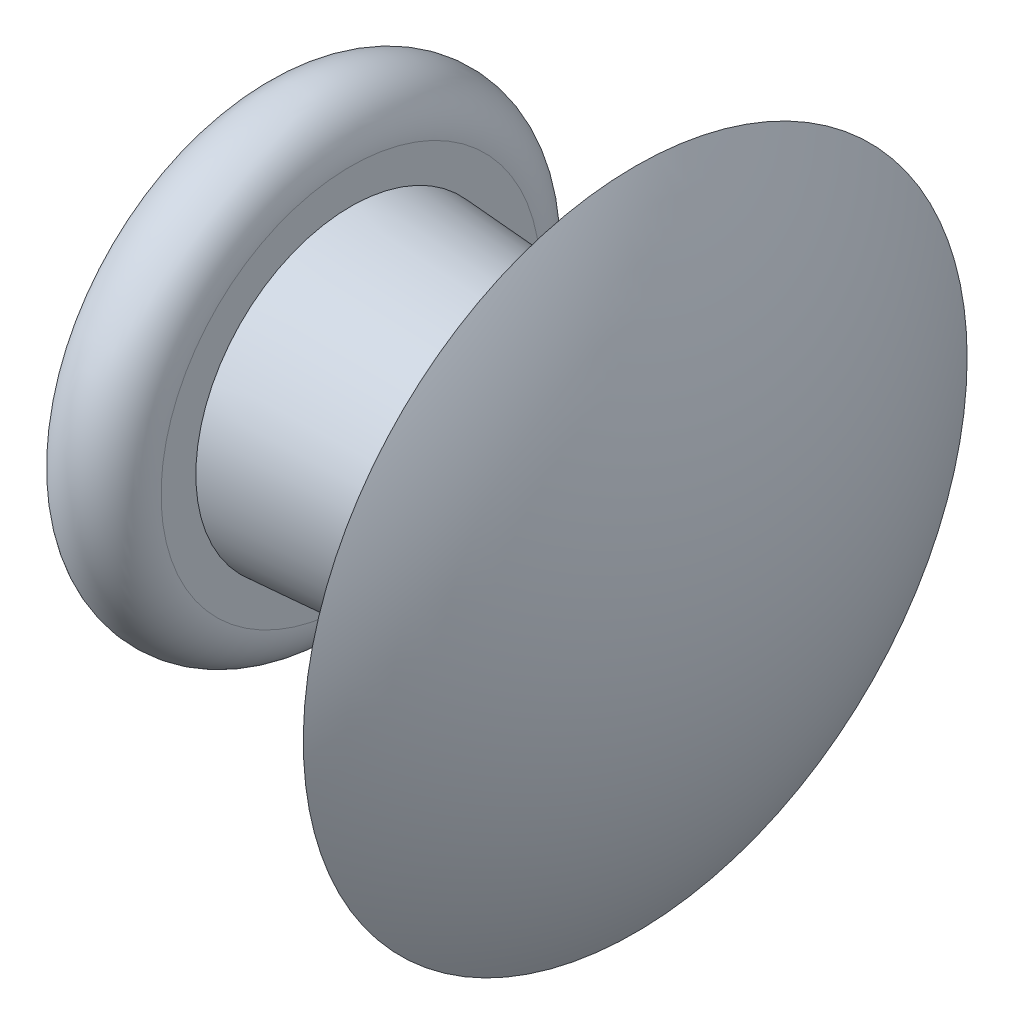
from build123d import *

# Parameters (mm, degrees)
CUT_EXTRUDE_1_DEPTH      = 64.231655884
CUT_EXTRUDE_1_DEPTH_BACK = 64.231655884
SKETCH_1_W               = 40
SKETCH_1_H               = 9


# Read off the part's stored shape, not the designer's step: Кнопка канцелярская
with BuildPart() as part:
    # Other 325 outline → Other 325 (revolve)
    with BuildSketch(Plane(origin=(0, 17.801844428, 11.6152978), x_dir=(0, 1, 0), z_dir=(0, 0, -1))):
        with BuildLine():
            Line((0, -32.931249855), (0, -44.931249855))
            Line((0, -44.931249855), (4.5, -44.931249855))
            ThreePointArc((4.5, -44.931249855), (3.767766953, -43.163482902), (2, -42.431249855))
            Line((2, -42.431249855), (1.5, -34.931249855))
            Line((1.5, -34.931249855), (3.500000006, -33.931249858))
            ThreePointArc((3.500000006, -33.931249858), (1.820027476, -33.186153702), (0, -32.931249855))
        make_face()
    revolve(axis=Axis((0, 17.801844428, 11.6152978), (1, 0, 0)))


with BuildPart() as body_2:
    # Other 325 2 outline → Other 325 2 (revolve)
    with BuildSketch(Plane(origin=(0, 17.801844428, 11.6152978), x_dir=(0, 1, 0), z_dir=(0, 0, -1))):
        with BuildLine():
            Line((0.6, -44.931249855), (0, -44.931249855))
            Line((0, -44.931249855), (0, -56.931249855))
            Line((0, -56.931249855), (0.489363529, -53.66882633))
            ThreePointArc((0.489363529, -53.66882633), (0.572302525, -52.929184099), (0.6, -52.185421801))
            Line((0.6, -52.185421801), (0.6, -44.931249855))
        make_face()
    revolve(axis=Axis((0, 17.801844428, 11.6152978), (1, 0, 0)))


with BuildPart() as cut_extrude_1_tool:
    # Эскиз1 → Вырез-Вытянуть1 (new, two sides: drawn at the far end of the back side and taken through both)
    with BuildSketch(Plane.XY.offset(-CUT_EXTRUDE_1_DEPTH_BACK)):
        with Locations((-56.931249855, 17.801844428)):
            Rectangle(SKETCH_1_W, SKETCH_1_H)
    extrude(amount=CUT_EXTRUDE_1_DEPTH + CUT_EXTRUDE_1_DEPTH_BACK)


with BuildPart() as part_1:
    add(part.part)

    # Вырез-Вытянуть1: cut by cut_extrude_1_tool
    add(cut_extrude_1_tool.part, mode=Mode.SUBTRACT)

    # Эскиз2 → Повернуть1 (revolve)
    with BuildSketch(Plane(origin=(-44.931249855, 17.801844428, 11.6152978), x_dir=(1, 0, 0), z_dir=(0, 0, 1)), mode=Mode.PRIVATE) as revolve_1_sk:
        with BuildLine():
            Line((8, 0), (8, 2))
            ThreePointArc((8, 2), (7.5, 2.5), (7, 2))
            Line((7, 2), (7, 0))
            Line((7, 0), (8, 0))
        make_face()
    revolve(revolve_1_sk.sketch.rotate(Axis((-36.931249855, 17.801844428, 11.6152978), (-1, 0, 0)), 90), axis=Axis((-36.931249855, 17.801844428, 11.6152978), (-1, 0, 0)))


with BuildPart() as body_2_1:
    add(body_2.part)

    # Вырез-Вытянуть1: cut by cut_extrude_1_tool
    add(cut_extrude_1_tool.part, mode=Mode.SUBTRACT)


solid = part_1.part
